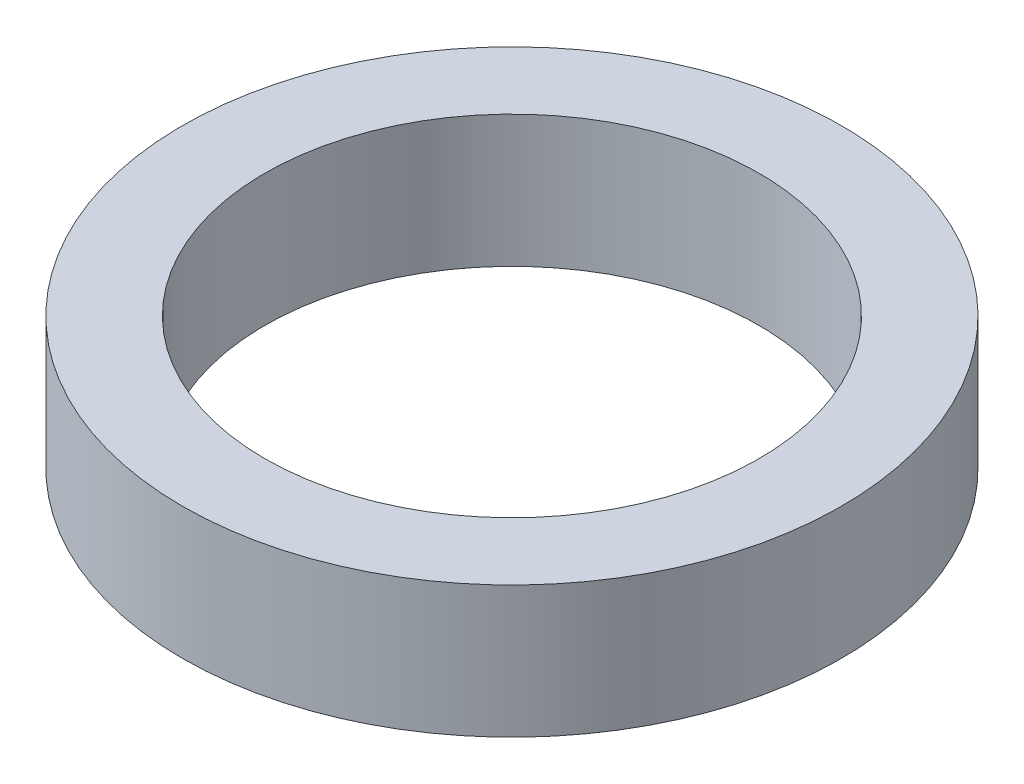
from build123d import *

# Parameters (mm, degrees)
SKETCH1_R           = 60
BOSS_EXTRUDE1_DEPTH = 24
SKETCH2_R           = 45
CUT_EXTRUDE1_DEPTH  = 89.18163074


with BuildPart() as part:
    # Sketch1 → Boss-Extrude1 (new body)
    with BuildSketch(Plane(origin=(0, 0, 0), x_dir=(1, 0, 0), z_dir=(0, 1, 0))):
        Circle(SKETCH1_R)
    extrude(amount=BOSS_EXTRUDE1_DEPTH)

    # Sketch2 → Cut-Extrude1 (cut, through all)
    with BuildSketch(Plane(origin=(0, 0, 0), x_dir=(1, 0, 0), z_dir=(0, 1, 0))):
        Circle(SKETCH2_R)
    extrude(amount=CUT_EXTRUDE1_DEPTH, mode=Mode.SUBTRACT)


solid = part.part
